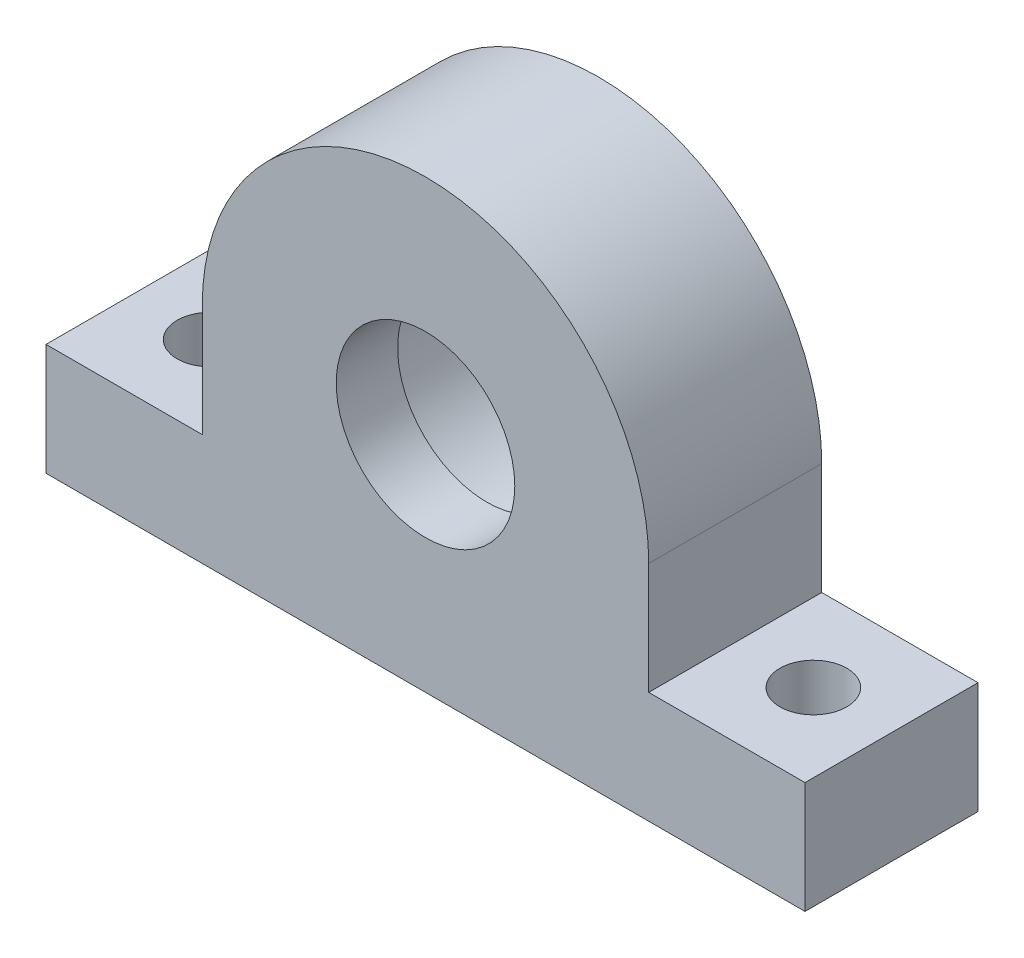
from build123d import *

# Parameters (mm, degrees)
SKETCH1_R           = 10.9
BOSS_EXTRUDE1_DEPTH = 10
SKETCH2_R           = 8
BOSS_EXTRUDE2_DEPTH = 5.5
SKETCH3_R           = 3
CUT_EXTRUDE1_DEPTH  = 48.919202831


with BuildPart() as part:
    # Sketch1 → Boss-Extrude1 (new body)
    with BuildSketch(Plane.XY):
        with BuildLine():
            Line((-34, 0), (34, 0))
            Line((34, 0), (34, 10))
            Line((34, 10), (20, 10))
            Line((20, 10), (20, 20))
            ThreePointArc((20, 20), (0, 40), (-20, 20))
            Line((-20, 20), (-20, 10))
            Line((-20, 10), (-34, 10))
            Line((-34, 10), (-34, 0))
        make_face()
        with Locations((0, 20)):
            Circle(SKETCH1_R, mode=Mode.SUBTRACT)
    extrude(amount=BOSS_EXTRUDE1_DEPTH)

    # Sketch2 → Boss-Extrude2 (add)
    with BuildSketch(Plane.XY.offset(10)):
        with BuildLine():
            Line((34, 0), (34, 10))
            Line((34, 10), (20, 10))
            Line((20, 10), (20, 20))
            ThreePointArc((20, 20), (0, 40), (-20, 20))
            Line((-20, 20), (-20, 10))
            Line((-20, 10), (-34, 10))
            Line((-34, 10), (-34, 0))
            Line((-34, 0), (34, 0))
        make_face()
        with Locations((0, 20)):
            Circle(SKETCH2_R, mode=Mode.SUBTRACT)
    extrude(amount=BOSS_EXTRUDE2_DEPTH)

    # Sketch3 → Cut-Extrude1 (cut, through all)
    with BuildSketch(Plane(origin=(0, 10, 0), x_dir=(1, 0, 0), z_dir=(0, 1, 0))):
        with Locations((27, -7.75)):
            Circle(SKETCH3_R)
        with Locations((-27, -7.75)):
            Circle(SKETCH3_R)
    extrude(amount=-CUT_EXTRUDE1_DEPTH, mode=Mode.SUBTRACT)


solid = part.part
